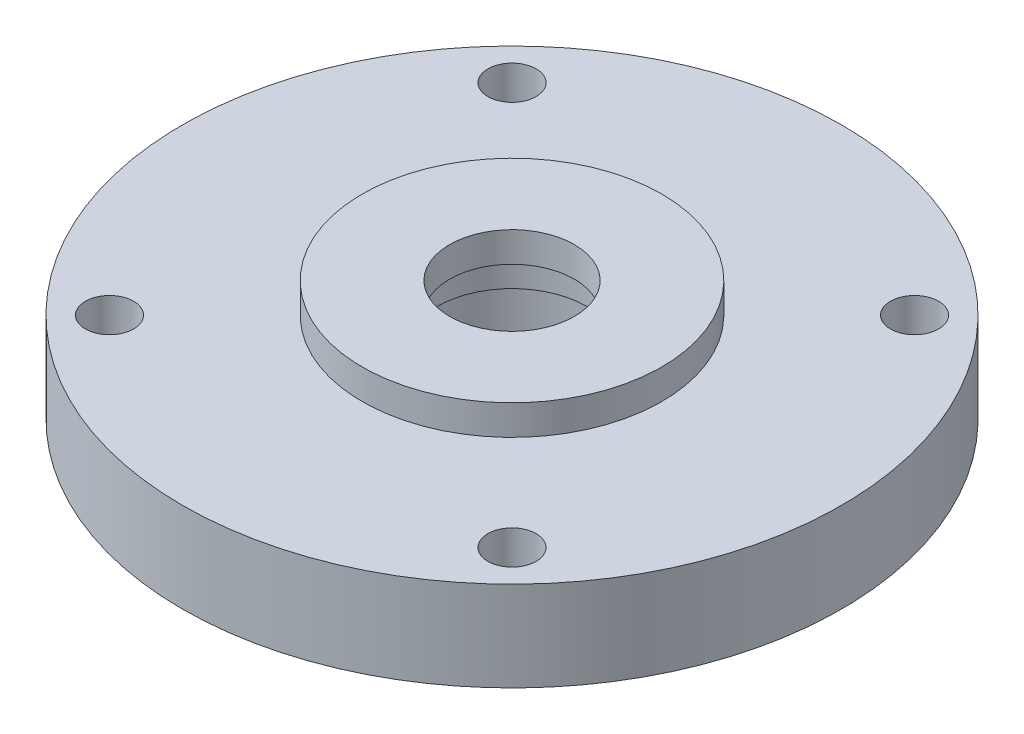
from build123d import *

# Parameters (mm, degrees)
F_10_CLEARANCE_HOLE1_D     = 5.1054
F_10_CLEARANCE_HOLE1_DEPTH = 11.223561698
F_10_CLEARANCE_HOLE1_TIP   = 1.533816902


with BuildPart() as part:
    # Sketch1 → Revolve1 (revolve)
    with BuildSketch(Plane.XY):
        Polygon((-15.875, 12.7), (-6.604, 12.7), (-6.604, 9.525), (-7.9375, 9.525), (-7.9375, 6.35), (-9.515, 6.35), (-9.515, 0), (-20.6375, 0), (-20.6375, 3.1369), (-25.4, 3.1369), (-25.4, 0), (-34.925, 0), (-34.925, 9.525), (-15.875, 9.525), align=None)
    revolve(axis=Axis((0, 0, 0), (0, 1, 0)))

    # #10 Clearance Hole1
    with Locations(Plane(origin=(0, 9.525, 0), x_dir=(1, 0, 0), z_dir=(0, 1, 0))):
        with Locations((-21.328108288, 21.328108288), (21.328108288, 21.328108288), (21.328108288, -21.328108288), (-21.328108288, -21.328108288)):
            Hole(F_10_CLEARANCE_HOLE1_D / 2, depth=F_10_CLEARANCE_HOLE1_DEPTH)
            with Locations((0, 0, -(F_10_CLEARANCE_HOLE1_DEPTH + F_10_CLEARANCE_HOLE1_TIP / 2))):  # 118° drill point
                Cone(0, F_10_CLEARANCE_HOLE1_D / 2, F_10_CLEARANCE_HOLE1_TIP, mode=Mode.SUBTRACT)


solid = part.part
